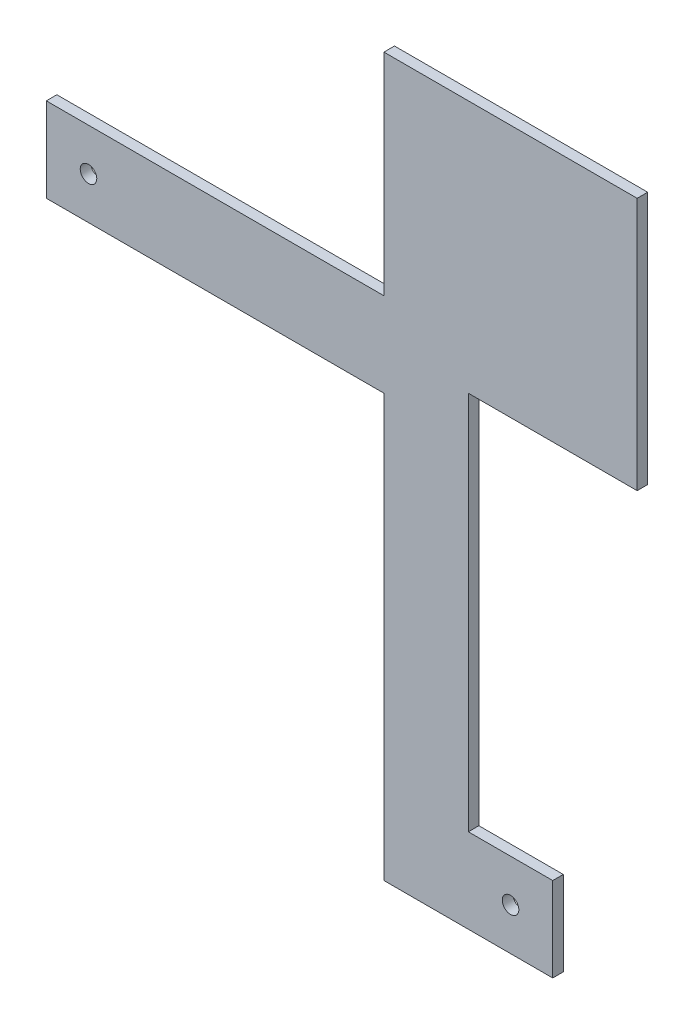
from build123d import *

# Parameters (mm, degrees)
BOSS_EXTRUDE1_DEPTH        = 3.175
F_9_0_196_DIAMETER_HOLE1_D = 4.9784


with BuildPart() as part:
    # Sketch1 → Boss-Extrude1 (new body)
    with BuildSketch(Plane(origin=(0, 0, 0), x_dir=(0, 1, 0), z_dir=(0, 0, 1))):
        Polygon((-82.55, -12.7), (-82.55, -38.1), (-107.95, -38.1), (-107.95, 12.7), (19.05, 12.7), (19.05, 114.3), (44.45, 114.3), (44.45, 12.7), (107.95, 12.7), (107.95, -63.5), (31.75, -63.5), (31.75, -12.7), align=None)
    extrude(amount=BOSS_EXTRUDE1_DEPTH)

    # #9 (0.196) Diameter Hole1 (through all)
    with Locations(Plane.XY.offset(3.175)):
        with Locations((25.4, -95.25), (-153.251995768, -35.15541816), (-101.6, 31.75), (-174.461563536, 15.375329004)):
            Hole(F_9_0_196_DIAMETER_HOLE1_D / 2)


solid = part.part
